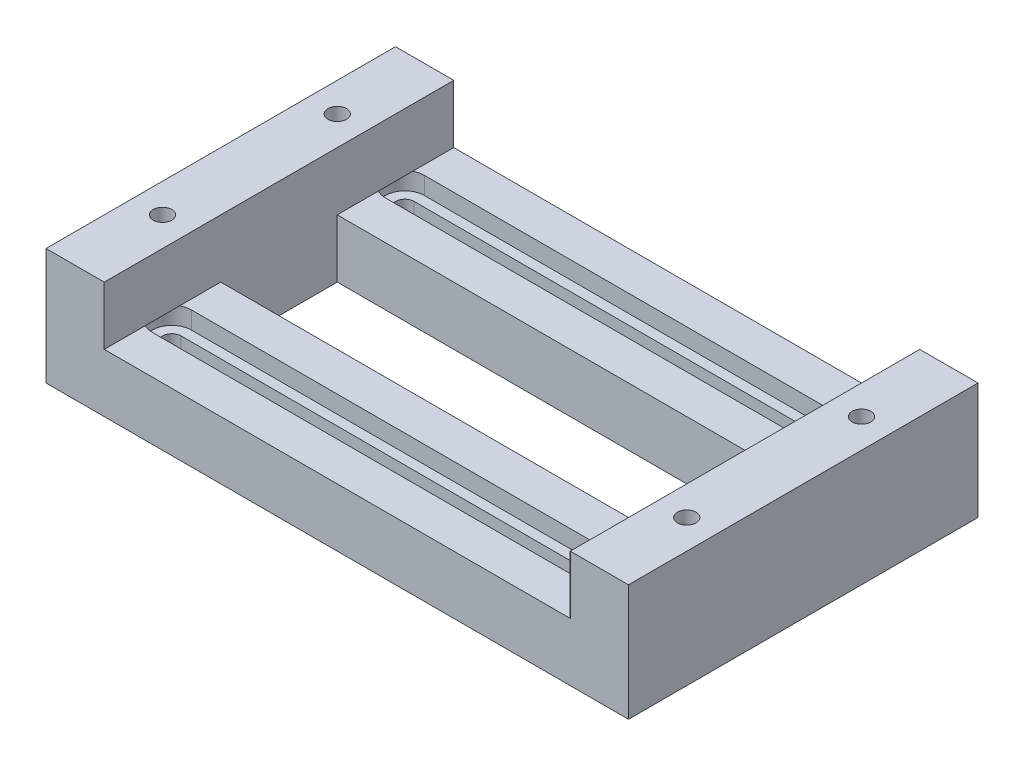
from build123d import *

# Parameters (mm, degrees)
SKETCH1_R             = 1.6
BOSS_EXTRUDE1_DEPTH   = 10
CUT_SLOT_INSETS_DEPTH = 3
SKETCH5_W             = 10
SKETCH5_H             = 60
SKETCH5_R             = 1.6
BOSS_EXTRUDE3_DEPTH   = 10
SKETCH6_R             = 3.75
CUT_EXTRUDE1_DEPTH    = 2.5


with BuildPart() as part:
    # Sketch1 → Boss-Extrude1 (new body)
    with BuildSketch(Plane(origin=(0, 0, 0), x_dir=(1, 0, 0), z_dir=(0, 1, 0))):
        Polygon((100, 60), (50, 60), (0, 60), (0, 0), (100, 0), align=None)
        with Locations((5, 15)):
            Circle(SKETCH1_R, mode=Mode.SUBTRACT)
        with BuildLine():
            ThreePointArc((11.6, 8.4), (10, 10), (11.6, 11.6))
            Line((11.6, 11.6), (88.4, 11.6))
            ThreePointArc((88.4, 11.6), (90, 10), (88.4, 8.4))
            Line((88.4, 8.4), (11.6, 8.4))
        make_face(mode=Mode.SUBTRACT)
        Polygon((10, 20), (10, 40), (50, 40), (90, 40), (90, 20), align=None, mode=Mode.SUBTRACT)
        with Locations((95, 15)):
            Circle(SKETCH1_R, mode=Mode.SUBTRACT)
        with Locations((5, 45)):
            Circle(SKETCH1_R, mode=Mode.SUBTRACT)
        with BuildLine():
            Line((88.4, 48.4), (50, 48.4))
            Line((50, 48.4), (11.6, 48.4))
            ThreePointArc((11.6, 48.4), (10, 50), (11.6, 51.6))
            Line((11.6, 51.6), (50, 51.6))
            Line((50, 51.6), (88.4, 51.6))
            ThreePointArc((88.4, 51.6), (90, 50), (88.4, 48.4))
        make_face(mode=Mode.SUBTRACT)
        with Locations((95, 45)):
            Circle(SKETCH1_R, mode=Mode.SUBTRACT)
    extrude(amount=BOSS_EXTRUDE1_DEPTH)

    # Sketch3 → Cut-Slot insets (cut)
    with BuildSketch(Plane(origin=(0, 10, 0), x_dir=(1, 0, 0), z_dir=(0, 1, 0))):
        with BuildLine():
            Line((88.4, 13.35), (11.6, 13.35))
            ThreePointArc((11.6, 13.35), (8.25, 10), (11.6, 6.65))
            Line((11.6, 6.65), (88.4, 6.65))
            ThreePointArc((88.4, 6.65), (91.75, 10), (88.4, 13.35))
        make_face()
        with BuildLine():
            Line((88.4, 53.35), (11.6, 53.35))
            ThreePointArc((11.6, 53.35), (8.25, 50), (11.6, 46.65))
            Line((11.6, 46.65), (88.4, 46.65))
            ThreePointArc((88.4, 46.65), (91.75, 50), (88.4, 53.35))
        make_face()
    extrude(amount=-CUT_SLOT_INSETS_DEPTH, mode=Mode.SUBTRACT)

    # Sketch5 → Boss-Extrude3 (add)
    # profile 1 of 2: a face of its own
    with BuildSketch(Plane(origin=(0, 10, 0), x_dir=(1, 0, 0), z_dir=(0, 1, 0))):
        with Locations((5, 30)):
            Rectangle(SKETCH5_W, SKETCH5_H)
        with Locations((5, 15)):
            Circle(SKETCH5_R, mode=Mode.SUBTRACT)
        with Locations((5, 45)):
            Circle(SKETCH5_R, mode=Mode.SUBTRACT)
    # profile 2 of 2: a face of its own
    with BuildSketch(Plane(origin=(0, 10, 0), x_dir=(1, 0, 0), z_dir=(0, 1, 0))):
        with Locations((95, 30)):
            Rectangle(SKETCH5_W, SKETCH5_H)
        with Locations((95, 45)):
            Circle(SKETCH5_R, mode=Mode.SUBTRACT)
        with Locations((95, 15)):
            Circle(SKETCH5_R, mode=Mode.SUBTRACT)
    extrude(amount=BOSS_EXTRUDE3_DEPTH)

    # Sketch6 → Cut-Extrude1 (cut)
    with BuildSketch(Plane.XZ):
        with Locations((5, -45)):
            Circle(SKETCH6_R)
        with Locations((5, -15)):
            Circle(SKETCH6_R)
        with Locations((95, -15)):
            Circle(SKETCH6_R)
        with Locations((95, -45)):
            Circle(SKETCH6_R)
    extrude(amount=-CUT_EXTRUDE1_DEPTH, mode=Mode.SUBTRACT)


solid = part.part
